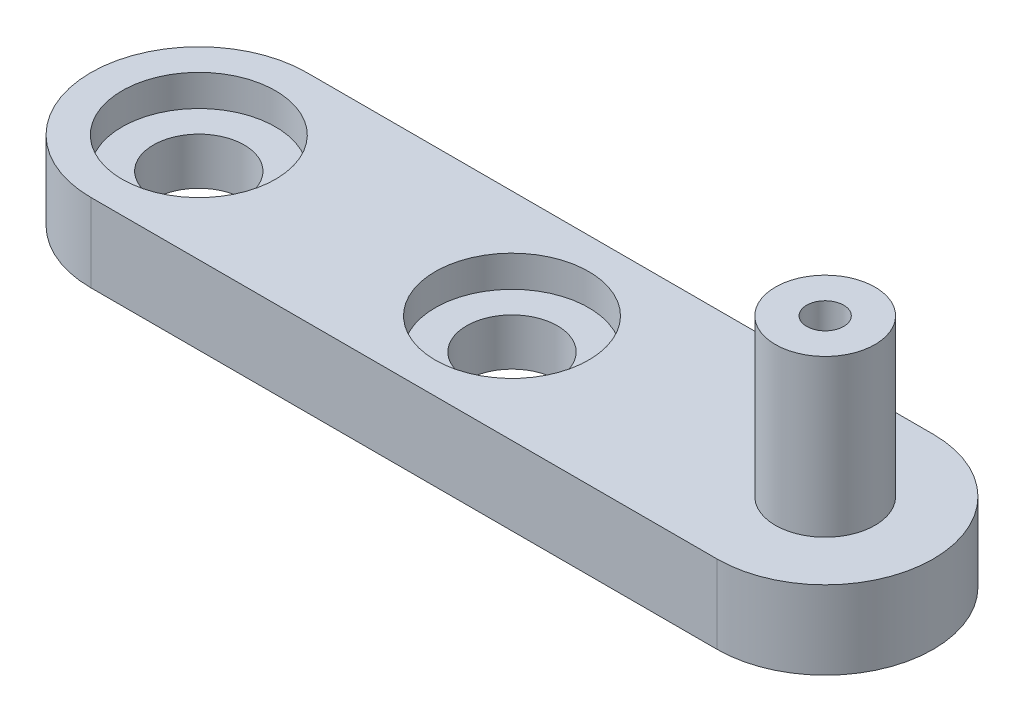
from build123d import *

# Parameters (mm, degrees)
CROQUIS2_R              = 1.45
SALIENTE_EXTRUIR1_DEPTH = 2.5
CROQUIS4_R              = 2.45
CORTAR_EXTRUIR1_DEPTH   = 1
CROQUIS5_R              = 1.59
CROQUIS5_R_2            = 0.59
SALIENTE_EXTRUIR2_DEPTH = 5
CROQUIS6_R              = 0.475
CORTAR_EXTRUIR2_DEPTH   = 25.224058289


with BuildPart() as part:
    # Croquis2 → Saliente-Extruir1 (new body)
    with BuildSketch(Plane(origin=(0, 0, 0), x_dir=(1, 0, 0), z_dir=(0, 1, 0))):
        with BuildLine():
            Line((0, 3.45), (20, 3.45))
            ThreePointArc((20, 3.45), (23.45, 0), (20, -3.45))
            Line((20, -3.45), (0, -3.45))
            ThreePointArc((0, -3.45), (-3.45, 0), (0, 3.45))
        make_face()
        Circle(CROQUIS2_R, mode=Mode.SUBTRACT)
        with Locations((10, 0)):
            Circle(CROQUIS2_R, mode=Mode.SUBTRACT)
    extrude(amount=SALIENTE_EXTRUIR1_DEPTH)

    # Croquis4 → Cortar-Extruir1 (cut)
    with BuildSketch(Plane(origin=(0, 2.5, 0), x_dir=(1, 0, 0), z_dir=(0, 1, 0))):
        Circle(CROQUIS4_R)
        with Locations((10, 0)):
            Circle(CROQUIS4_R)
    extrude(amount=-CORTAR_EXTRUIR1_DEPTH, mode=Mode.SUBTRACT)

    # Croquis5 → Saliente-Extruir2 (add)
    with BuildSketch(Plane(origin=(0, 2.5, 0), x_dir=(1, 0, 0), z_dir=(0, 1, 0))):
        with Locations((20, 0)):
            Circle(CROQUIS5_R)
        with Locations((20, 0)):
            Circle(CROQUIS5_R_2, mode=Mode.SUBTRACT)
    extrude(amount=SALIENTE_EXTRUIR2_DEPTH)

    # Croquis6 → Cortar-Extruir2 (cut, through all)
    with BuildSketch(Plane(origin=(0, 2.5, 0), x_dir=(1, 0, 0), z_dir=(0, 1, 0))):
        with Locations((20, 0)):
            Circle(CROQUIS6_R)
    extrude(amount=-CORTAR_EXTRUIR2_DEPTH, mode=Mode.SUBTRACT)


solid = part.part
